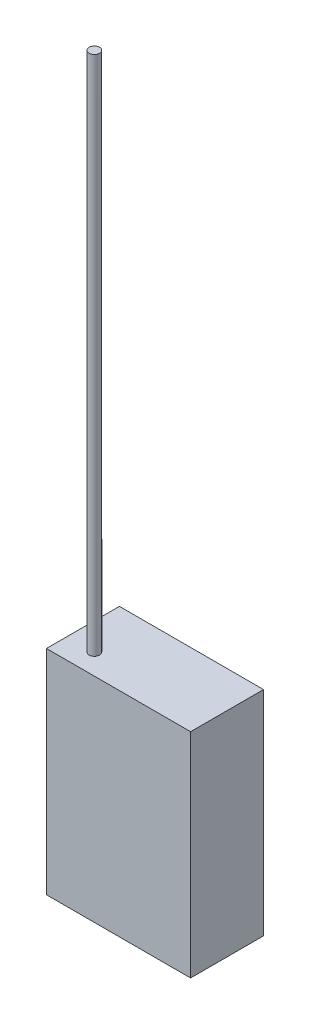
from build123d import *

# Parameters (mm, degrees)
SKETCH1_W           = 13.826897396
SKETCH1_H           = 20.463808146
BOSS_EXTRUDE1_DEPTH = 7
SKETCH2_R           = 0.5
BOSS_EXTRUDE2_DEPTH = 50


with BuildPart() as part:
    # Sketch1 → Boss-Extrude1 (new body)
    with BuildSketch(Plane.XY):
        with Locations((-56.093861986, 1.78803904)):
            Rectangle(SKETCH1_W, SKETCH1_H)
    extrude(amount=BOSS_EXTRUDE1_DEPTH)

    # Sketch2 → Boss-Extrude2 (add)
    with BuildSketch(Plane(origin=(0, 12.019943113, 0), x_dir=(1, 0, 0), z_dir=(0, 1, 0))):
        with Locations((-60.408534805, -5)):
            Circle(SKETCH2_R)
    extrude(amount=BOSS_EXTRUDE2_DEPTH)


solid = part.part
